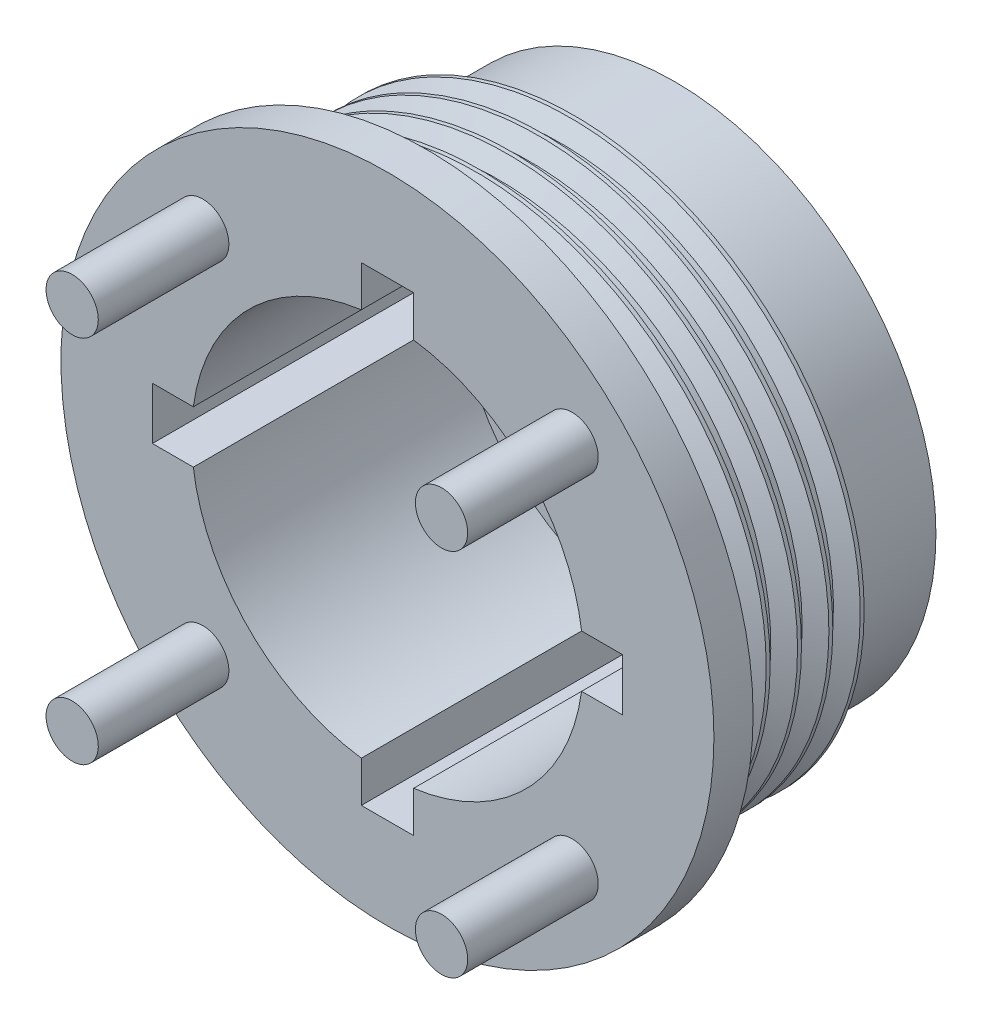
from build123d import *
from build123d.topology import SkipClean

# Parameters (mm, degrees)
SKETCH1_R               = 6.25
SKETCH1_R_2             = 3.75
BOSS_EXTRUDE1_DEPTH     = 5
BOSS_EXTRUDE2_START     = 3
SKETCH2_R               = 5.5
SKETCH2_R_2             = 3.75
BOSS_EXTRUDE2_DEPTH     = 3
THREAD1_PITCH           = 0.6
BOSS_EXTRUDE3_START     = 1.25
SKETCH7_R               = 5
SKETCH7_R_2             = 3.75
BOSS_EXTRUDE3_DEPTH     = 1.25
CUT_EXTRUDE3_DEPTH      = 6.5
CUT_EXTRUDE3_DEPTH_BACK = 5.5
SKETCH5_W               = 1
SKETCH5_H               = 1
BOSS_EXTRUDE4_START     = 0.5
SKETCH8_R               = 5
SKETCH8_R_2             = 3
BOSS_EXTRUDE4_DEPTH     = 0.5
CUT_EXTRUDE4_DEPTH      = 10
CUT_EXTRUDE4_DEPTH_BACK = 10
SKETCH9_W               = 38.735002209
SKETCH9_H               = 9.075499022
SKETCH10_R              = 0.5
BOSS_EXTRUDE5_DEPTH     = 2.5
CIRPATTERN1_COUNT       = 4
CUT_EXTRUDE5_START      = -0.1
CUT_EXTRUDE5_DEPTH      = 0.1


with BuildPart() as part:
    # Sketch1 → Boss-Extrude1 (new body)
    with BuildSketch(Plane.XY):
        Circle(SKETCH1_R)
        Circle(SKETCH1_R_2, mode=Mode.SUBTRACT)
    extrude(amount=BOSS_EXTRUDE1_DEPTH)

    # Sketch2 → Boss-Extrude2 (add)
    with SkipClean():  # the faces are left unmerged after this step: merging them gives an invalid solid
        with BuildSketch(Plane(origin=(0, 0, 0), x_dir=(-1, 0, 0), z_dir=(0, 0, -1)).offset(BOSS_EXTRUDE2_START)):
            Circle(SKETCH2_R)
            Circle(SKETCH2_R_2, mode=Mode.SUBTRACT)
        extrude(amount=-BOSS_EXTRUDE2_DEPTH)

    # Thread1: the profile of Thread Profile1 profile screwed along a right-hand helix of 6.666667 turns, 6 arcs to a turn; built about Z, then put on its axis
    with SkipClean():  # the faces are left unmerged after this step: merging them gives an invalid solid
        thread1_z = Axis((0, 0, 0), (0, 0, 1))
        thread1_corners = [(5.5003, 0, -0.000173205), (5.5003, 0, 0.525173203), (5.175240475, 0, 0.337499999), (5.175240475, 0, 0.187499999)]
        with BuildLine(mode=Mode.PRIVATE) as thread1_profile:
            Line(thread1_corners[0], thread1_corners[1])
            Line(thread1_corners[1], thread1_corners[2])
            Line(thread1_corners[2], thread1_corners[3])
            Line(thread1_corners[3], thread1_corners[0])
        thread1_cap = Face(thread1_profile.wire())
        thread1_turn_angles = [0, 30, 60, 90, 120, 150, 180, 210, 240, 270, 300, 330, 360]
        thread1_turn_weights = [1, 0.8660254037844387, 1, 0.8660254037844387, 1, 0.8660254037844387, 1, 0.8660254037844387, 1, 0.8660254037844387, 1, 0.8660254037844387, 1]
        thread1_turn_rails = [Edge.make_bspline([Vector(p[0], p[1], 0).rotate(thread1_z, thread1_turn_angles[k]) / thread1_turn_weights[k] + Vector(0, 0, p[2] + THREAD1_PITCH * thread1_turn_angles[k] / 360) for k in range(13)], [0, 0, 0, 1, 1, 2, 2, 3, 3, 4, 4, 5, 5, 6, 6, 6], 2, thread1_turn_weights) for p in thread1_corners]
        thread1_turn_sides = [Face.make_surface_from_curves(thread1_turn_rails[p[0]], thread1_turn_rails[p[1]]) for p in [(0, 1), (1, 2), (2, 3), (3, 0)]]
        thread1_last_angles = [2160, 2190, 2220, 2250, 2280, 2310, 2340, 2370, 2400]
        thread1_last_weights = [1, 0.8660254037844387, 1, 0.8660254037844387, 1, 0.8660254037844387, 1, 0.8660254037844387, 1]
        thread1_last_rails = [Edge.make_bspline([Vector(p[0], p[1], 0).rotate(thread1_z, thread1_last_angles[k]) / thread1_last_weights[k] + Vector(0, 0, p[2] + THREAD1_PITCH * thread1_last_angles[k] / 360) for k in range(9)], [0, 0, 0, 1, 1, 2, 2, 3, 3, 4, 4, 4], 2, thread1_last_weights) for p in thread1_corners]
        thread1_last_sides = [Face.make_surface_from_curves(thread1_last_rails[p[0]], thread1_last_rails[p[1]]) for p in [(0, 1), (1, 2), (2, 3), (3, 0)]]
        thread1 = Plane(origin=(0, 0, -4), x_dir=(1, 0, 0), z_dir=(0, 0, 1)) * Solid(Shell([*[p.moved(Location((0, 0, THREAD1_PITCH * i))) for i in range(6) for p in thread1_turn_sides], *thread1_last_sides, thread1_cap, thread1_cap.rotate(thread1_z, 2400).moved(Location((0, 0, THREAD1_PITCH * 2400 / 360)))]))
        add(thread1, mode=Mode.SUBTRACT)

    # Sketch7 → Boss-Extrude3 (add)
    with SkipClean():  # the faces are left unmerged after this step: merging them gives an invalid solid
        with BuildSketch(Plane(origin=(0, 0, -3), x_dir=(-1, 0, 0), z_dir=(0, 0, -1)).offset(BOSS_EXTRUDE3_START)):
            Circle(SKETCH7_R)
            Circle(SKETCH7_R_2, mode=Mode.SUBTRACT)
        extrude(amount=-BOSS_EXTRUDE3_DEPTH)

    # Sketch5 → Cut-Extrude3 (cut, two sides: drawn at the far end of the back side and taken through both)
    with BuildSketch(Plane(origin=(0, 0, -3), x_dir=(-1, 0, 0), z_dir=(0, 0, -1)).offset(-CUT_EXTRUDE3_DEPTH_BACK)):
        with Locations((4, 0)):
            Rectangle(SKETCH5_W, SKETCH5_H)
        with Locations((0, 4)):
            Rectangle(SKETCH5_W, SKETCH5_H)
        with Locations((0, -4)):
            Rectangle(SKETCH5_W, SKETCH5_H)
        with Locations((-4, 0)):
            Rectangle(SKETCH5_W, SKETCH5_H)
    extrude(amount=CUT_EXTRUDE3_DEPTH + CUT_EXTRUDE3_DEPTH_BACK, mode=Mode.SUBTRACT)

    # Sketch8 → Boss-Extrude4 (add)
    with BuildSketch(Plane(origin=(0, 0, -4.25), x_dir=(-1, 0, 0), z_dir=(0, 0, -1)).offset(BOSS_EXTRUDE4_START)):
        Circle(SKETCH8_R)
        Circle(SKETCH8_R_2, mode=Mode.SUBTRACT)
    extrude(amount=-BOSS_EXTRUDE4_DEPTH)

    # Sketch9 → Cut-Extrude4 (cut, two sides: drawn at the far end of the back side and taken through both)
    with BuildSketch(Plane(origin=(0, 0, 0), x_dir=(1, 0, 0), z_dir=(0, 1, 0)).offset(-CUT_EXTRUDE4_DEPTH_BACK)):
        with Locations((2.027505101, -5.287749511)):
            Rectangle(SKETCH9_W, SKETCH9_H)
    extrude(amount=CUT_EXTRUDE4_DEPTH + CUT_EXTRUDE4_DEPTH_BACK, mode=Mode.SUBTRACT)

    # Sketch10 → Boss-Extrude5 (add)
    with BuildSketch(Plane.XY.offset(0.75)):
        with Locations((-3.535533906, 3.535533906)):
            Circle(SKETCH10_R)
    boss_extrude5 = extrude(amount=BOSS_EXTRUDE5_DEPTH)

    # CirPattern1: Boss-Extrude5 ×4 about axis
    cirpattern1_axis = Axis((0, 0, 0), (0, 0, 1))
    for i in range(1, CIRPATTERN1_COUNT):
        add(boss_extrude5.rotate(cirpattern1_axis, i * 360 / CIRPATTERN1_COUNT))

    # Sketch11 → Cut-Extrude5 (cut)
    with BuildSketch(Plane.XY.offset(-4.25).offset(CUT_EXTRUDE5_START)):
        with BuildLine():
            Line((-0.5, 4.5), (0.5, 4.5))
            Line((0.5, 4.5), (0.5, 3.716517187))
            ThreePointArc((0.5, 3.716517187), (2.651650429, 2.651650429), (3.716517187, 0.5))
            Line((3.716517187, 0.5), (4.5, 0.5))
            Line((4.5, 0.5), (4.5, -0.5))
            Line((4.5, -0.5), (3.716517187, -0.5))
            ThreePointArc((3.716517187, -0.5), (2.651650429, -2.651650429), (0.5, -3.716517187))
            Line((0.5, -3.716517187), (0.5, -4.5))
            Line((0.5, -4.5), (-0.5, -4.5))
            Line((-0.5, -4.5), (-0.5, -3.716517187))
            ThreePointArc((-0.5, -3.716517187), (-2.651650429, -2.651650429), (-3.716517187, -0.5))
            Line((-3.716517187, -0.5), (-4.5, -0.5))
            Line((-4.5, -0.5), (-4.5, 0.5))
            Line((-4.5, 0.5), (-3.716517187, 0.5))
            ThreePointArc((-3.716517187, 0.5), (-2.651650429, 2.651650429), (-0.5, 3.716517187))
            Line((-0.5, 3.716517187), (-0.5, 4.5))
        make_face()
    extrude(amount=CUT_EXTRUDE5_DEPTH, mode=Mode.SUBTRACT)


solid = part.part
